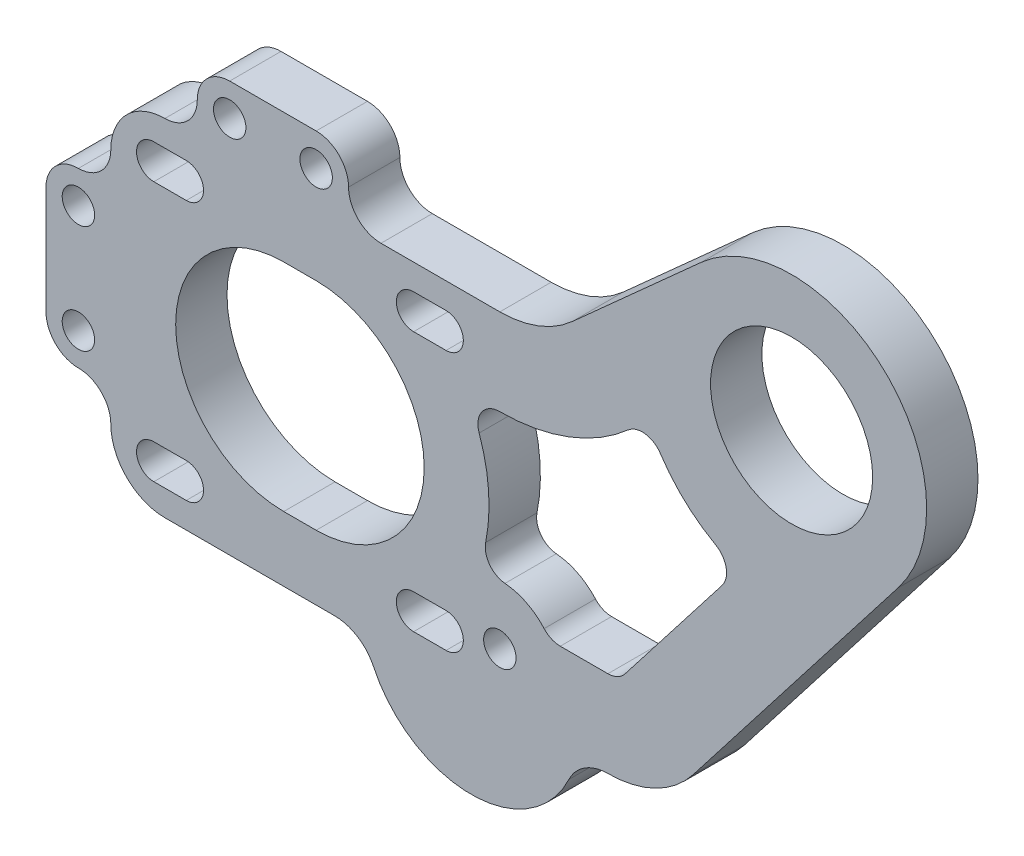
from build123d import *

# Parameters (mm, degrees)
SKETCH1_R               = 1.5
SKETCH1_R_2             = 7.5
BOSS_EXTRUDE1_DEPTH     = 2.375
CUT_EXTRUDE1_DEPTH      = 68.839078893
CUT_EXTRUDE1_DEPTH_BACK = 68.839078893


with BuildPart() as part:
    # Sketch1 → Boss-Extrude1 (new, symmetric)
    with BuildSketch(Plane.XY):
        with BuildLine():
            ThreePointArc((-11, 16), (-14.535533906, 14.535533906), (-16, 11))
            ThreePointArc((-16, 11), (-16.878679656, 8.878679656), (-19, 8))
            ThreePointArc((-19, 8), (-21.121320344, 7.121320344), (-22, 5))
            Line((-22, 5), (-22, -5))
            ThreePointArc((-22, -5), (-21.121320344, -7.121320344), (-19, -8))
            ThreePointArc((-19, -8), (-16.878679656, -8.878679656), (-16, -11))
            ThreePointArc((-16, -11), (-14.535533906, -14.535533906), (-11, -16))
            Line((-11, -16), (4.701778719, -16))
            ThreePointArc((4.701778719, -16), (6.839868654, -16.619382981), (8.31581033, -18.285714286))
            ThreePointArc((8.31581033, -18.285714286), (17.350889359, -24), (26.385968388, -18.285714286))
            ThreePointArc((26.385968388, -18.285714286), (27.861910065, -16.619382981), (30, -16))
            ThreePointArc((30, -16), (34.39981922, -14.980066304), (37.902133665, -12.128318166))
            Line((37.902133665, -12.128318166), (56.877667081, 12.339602293))
            ThreePointArc((56.877667081, 12.339602293), (55.515808728, 29.150464562), (38.650559602, 29.30251821))
            Line((38.650559602, 29.30251821), (26.679552318, 18.557985432))
            ThreePointArc((26.679552318, 18.557985432), (23.576300765, 16.66136665), (20, 16))
            Line((20, 16), (9, 16))
            ThreePointArc((9, 16), (6.878679656, 16.878679656), (6, 19))
            ThreePointArc((6, 19), (5.121320344, 21.121320344), (3, 22))
            Line((3, 22), (-5, 22))
            ThreePointArc((-5, 22), (-7.121320344, 21.121320344), (-8, 19))
            ThreePointArc((-8, 19), (-8.878679656, 16.878679656), (-11, 16))
        make_face()
        with BuildLine():
            ThreePointArc((0, -10), (-10, 0), (0, 10))
            Line((0, 10), (3, 10))
            ThreePointArc((3, 10), (13, 0), (3, -10))
            Line((3, -10), (0, -10))
        make_face(mode=Mode.SUBTRACT)
        with Locations((20, -11)):
            Circle(SKETCH1_R, mode=Mode.SUBTRACT)
        with BuildLine():
            Line((40.560975696, 4.354266843), (31.580426733, -7.225663633))
            ThreePointArc((31.580426733, -7.225663633), (30.879963844, -7.796013261), (30, -8))
            Line((30, -8), (25.590169944, -8))
            ThreePointArc((25.590169944, -8), (24.773673363, -7.825741858), (24.099457959, -7.333333333))
            ThreePointArc((24.099457959, -7.333333333), (22.461292287, -6.081459538), (20.47726218, -5.520746327))
            ThreePointArc((20.47726218, -5.520746327), (19.050581882, -4.727983476), (18.689610724, -3.136258174))
            ThreePointArc((18.689610724, -3.136258174), (18.959379998, 1.139381444), (18.084944665, 5.333333333))
            ThreePointArc((18.084944665, 5.333333333), (18.337569587, 7.154700538), (19.970562748, 8))
            Line((19.970562748, 8), (20, 8))
            ThreePointArc((20, 8), (26.437341377, 9.190459971), (32.023194173, 12.604373778))
            Line((32.023194173, 12.604373778), (31.856643012, 12.454886407))
            ThreePointArc((31.856643012, 12.454886407), (33.451803609, 12.949609654), (34.866183357, 12.061455191))
            ThreePointArc((34.866183357, 12.061455191), (37.121661875, 9.385461108), (39.952603634, 7.327817691))
            ThreePointArc((39.952603634, 7.327817691), (40.93995997, 5.980815134), (40.560975696, 4.354266843))
        make_face(mode=Mode.SUBTRACT)
        with Locations((3, 19)):
            Circle(SKETCH1_R, mode=Mode.SUBTRACT)
        with Locations((-5, 19)):
            Circle(SKETCH1_R, mode=Mode.SUBTRACT)
        with Locations((47, 20)):
            Circle(SKETCH1_R_2, mode=Mode.SUBTRACT)
        with Locations((-19, 5)):
            Circle(SKETCH1_R, mode=Mode.SUBTRACT)
        with Locations((-19, -5)):
            Circle(SKETCH1_R, mode=Mode.SUBTRACT)
    extrude(amount=BOSS_EXTRUDE1_DEPTH, both=True)

    # Sketch2 → Cut-Extrude1 (cut, two sides: drawn at the far end of the back side and taken through both)
    with BuildSketch(Plane.XY.offset(-CUT_EXTRUDE1_DEPTH_BACK)):
        with BuildLine():
            Line((-12.02081528, 13.62081528), (-9.02081528, 13.62081528))
            ThreePointArc((-9.02081528, 13.62081528), (-7.42081528, 12.02081528), (-9.02081528, 10.42081528))
            Line((-9.02081528, 10.42081528), (-12.02081528, 10.42081528))
            ThreePointArc((-12.02081528, 10.42081528), (-13.62081528, 12.02081528), (-12.02081528, 13.62081528))
        make_face()
        with BuildLine():
            Line((12.02081528, 13.62081528), (15.02081528, 13.62081528))
            ThreePointArc((15.02081528, 13.62081528), (16.62081528, 12.02081528), (15.02081528, 10.42081528))
            Line((15.02081528, 10.42081528), (12.02081528, 10.42081528))
            ThreePointArc((12.02081528, 10.42081528), (10.42081528, 12.02081528), (12.02081528, 13.62081528))
        make_face()
        with BuildLine():
            Line((-12.02081528, -10.42081528), (-9.02081528, -10.42081528))
            ThreePointArc((-9.02081528, -10.42081528), (-7.42081528, -12.02081528), (-9.02081528, -13.62081528))
            Line((-9.02081528, -13.62081528), (-12.02081528, -13.62081528))
            ThreePointArc((-12.02081528, -13.62081528), (-13.62081528, -12.02081528), (-12.02081528, -10.42081528))
        make_face()
        with BuildLine():
            Line((12.02081528, -10.42081528), (15.02081528, -10.42081528))
            ThreePointArc((15.02081528, -10.42081528), (16.62081528, -12.02081528), (15.02081528, -13.62081528))
            Line((15.02081528, -13.62081528), (12.02081528, -13.62081528))
            ThreePointArc((12.02081528, -13.62081528), (10.42081528, -12.02081528), (12.02081528, -10.42081528))
        make_face()
    extrude(amount=CUT_EXTRUDE1_DEPTH + CUT_EXTRUDE1_DEPTH_BACK, mode=Mode.SUBTRACT)


solid = part.part
